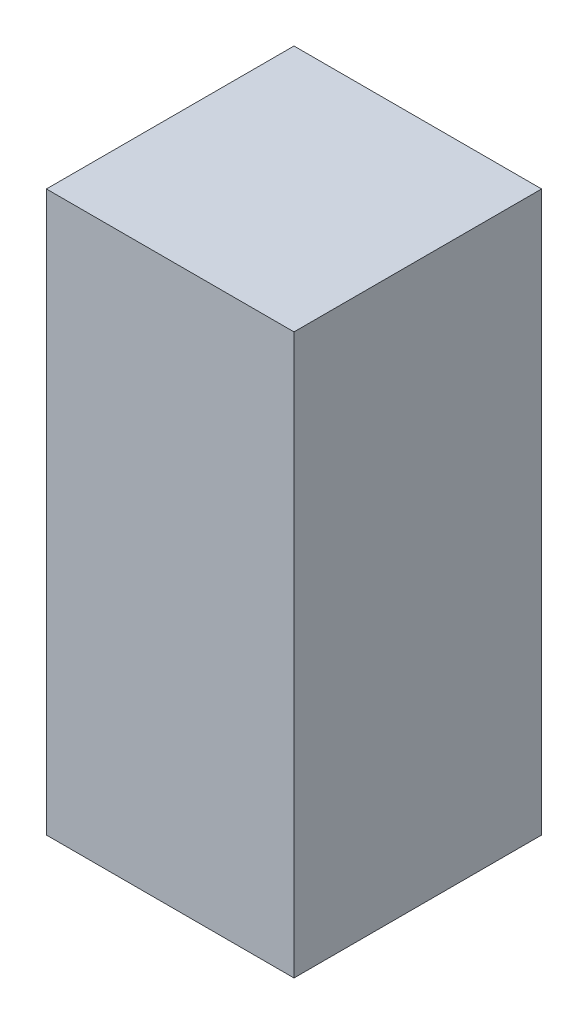
from build123d import *

# Parameters (mm, degrees)
SKETCH1_W           = 100
SKETCH1_H           = 100
BOSS_EXTRUDE1_DEPTH = 226


with BuildPart() as part:
    # Sketch1 → Boss-Extrude1 (new body)
    with BuildSketch(Plane(origin=(0, 0, 0), x_dir=(1, 0, 0), z_dir=(0, 1, 0))):
        Rectangle(SKETCH1_W, SKETCH1_H)
    extrude(amount=BOSS_EXTRUDE1_DEPTH)


solid = part.part
